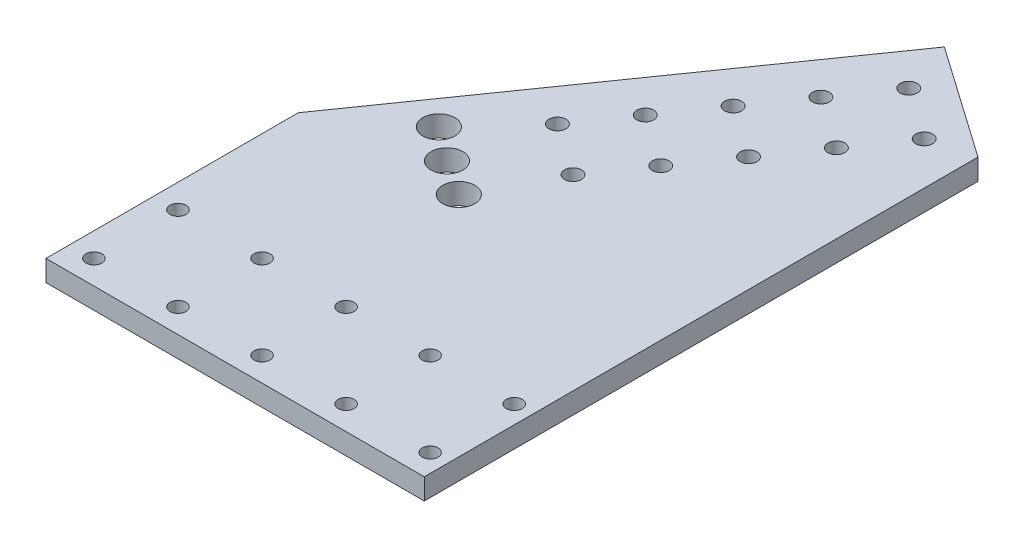
from build123d import *

# Parameters (mm, degrees)
SKETCH1_W           = 114.3
SKETCH1_H           = 203.2
BOSS_EXTRUDE1_DEPTH = 6.35
SKETCH2_R           = 2.413
CUT_EXTRUDE1_DEPTH  = 234.227469437
CUT_EXTRUDE4_DEPTH  = 234.227469437
SKETCH3_R           = 2.5527
CUT_EXTRUDE2_DEPTH  = 234.227469437
SKETCH6_R           = 4.826
CUT_EXTRUDE5_DEPTH  = 234.227469437
CUT_EXTRUDE6_DEPTH  = 234.227469437


with BuildPart() as part:
    # Sketch1 → Boss-Extrude1 (new body)
    with BuildSketch(Plane(origin=(0, 0, 0), x_dir=(1, 0, 0), z_dir=(0, 1, 0))):
        with Locations((57.15, 101.6)):
            Rectangle(SKETCH1_W, SKETCH1_H)
    extrude(amount=BOSS_EXTRUDE1_DEPTH)

    # Sketch2 → Cut-Extrude1 (cut, through all)
    with BuildSketch(Plane(origin=(0, 6.35, 0), x_dir=(1, 0, 0), z_dir=(0, 1, 0))):
        with Locations((7.239, 7.239)):
            Circle(SKETCH2_R)
        with Locations((7.239, 32.639)):
            Circle(SKETCH2_R)
        with Locations((32.639, 32.639)):
            Circle(SKETCH2_R)
        with Locations((58.039, 32.639)):
            Circle(SKETCH2_R)
        with Locations((83.439, 32.639)):
            Circle(SKETCH2_R)
        with Locations((108.839, 32.639)):
            Circle(SKETCH2_R)
        with Locations((32.639, 7.239)):
            Circle(SKETCH2_R)
        with Locations((58.039, 7.239)):
            Circle(SKETCH2_R)
        with Locations((83.439, 7.239)):
            Circle(SKETCH2_R)
        with Locations((108.839, 7.239)):
            Circle(SKETCH2_R)
    extrude(amount=-CUT_EXTRUDE1_DEPTH, mode=Mode.SUBTRACT)

    # Sketch5 → Cut-Extrude4 (cut, through all)
    with BuildSketch(Plane(origin=(0, 0, 0), x_dir=(-1, 0, 0), z_dir=(0, -1, 0))):
        Polygon((-88.9, 203.2), (0, 76.237642201), (0, 203.2), align=None)
    extrude(amount=-CUT_EXTRUDE4_DEPTH, mode=Mode.SUBTRACT)

    # Sketch3 → Cut-Extrude2 (cut, through all)
    with BuildSketch(Plane(origin=(0, 6.35, 0), x_dir=(1, 0, 0), z_dir=(0, 1, 0))):
        with Locations((90.481040709, 148.343758146)):
            Circle(SKETCH3_R)
        with Locations((74.876194266, 159.270389258)):
            Circle(SKETCH3_R)
        with Locations((63.949563153, 143.665542814)):
            Circle(SKETCH3_R)
        with Locations((79.554409597, 132.738911702)):
            Circle(SKETCH3_R)
        with Locations((68.627778484, 117.134065258)):
            Circle(SKETCH3_R)
        with Locations((53.022932041, 128.060696371)):
            Circle(SKETCH3_R)
        with Locations((42.096300928, 112.455849927)):
            Circle(SKETCH3_R)
        with Locations((57.701147372, 101.529218814)):
            Circle(SKETCH3_R)
        with Locations((85.802825375, 174.875235704)):
            Circle(SKETCH3_R)
        with Locations((101.407671819, 163.948604591)):
            Circle(SKETCH3_R)
    extrude(amount=-CUT_EXTRUDE2_DEPTH, mode=Mode.SUBTRACT)

    # Sketch6 → Cut-Extrude5 (cut, through all)
    with BuildSketch(Plane(origin=(0, 6.35, 0), x_dir=(1, 0, 0), z_dir=(0, 1, 0))):
        with Locations((24.926651696, 93.77679445)):
            Circle(SKETCH6_R)
        with Locations((35.048356715, 86.106)):
            Circle(SKETCH6_R)
        with Locations((45.638587952, 79.096220948)):
            Circle(SKETCH6_R)
    extrude(amount=-CUT_EXTRUDE5_DEPTH, mode=Mode.SUBTRACT)

    # Sketch7 → Cut-Extrude6 (cut, through all)
    with BuildSketch(Plane(origin=(0, 6.35, 0), x_dir=(1, 0, 0), z_dir=(0, 1, 0))):
        Polygon((80.400311338, 191.06118658), (114.3, 167.324369036), (114.3, 203.2), (88.9, 203.2), align=None)
    extrude(amount=-CUT_EXTRUDE6_DEPTH, mode=Mode.SUBTRACT)


solid = part.part
